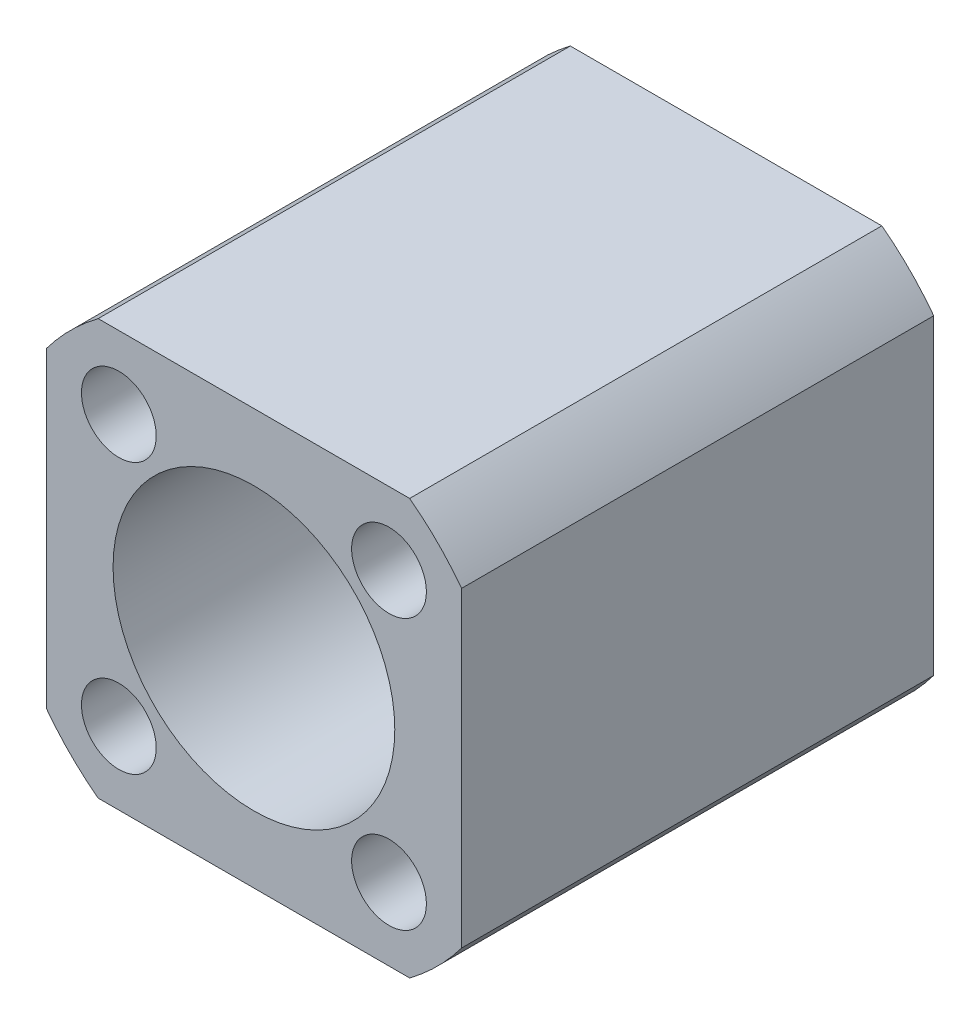
from build123d import *

# Parameters (mm, degrees)
SKETCH_1_R          = 9
EXTRUDE_1_DEPTH     = 113.684766057
EXTRUDE_START       = -113.684766057
EXTRUDE_3_OUTLINE_R = 33.917711518
EXTRUDE_3_DEPTH     = 113.684766057


# Read off the part's stored shape, not the designer's step: Вырез-Вытянуть3
with BuildPart() as part:
    # Эскиз1 → Бобышка-Вытянуть1 (new body)
    with BuildSketch(Plane.XY):
        with BuildLine():
            ThreePointArc((-50, -37.5), (-44.194173824, -44.194173824), (-37.5, -50))
            Line((-37.5, -50), (37.5, -50))
            ThreePointArc((37.5, -50), (44.194173824, -44.194173824), (50, -37.5))
            Line((50, -37.5), (50, 37.5))
            ThreePointArc((50, 37.5), (44.194173824, 44.194173824), (37.5, 50))
            Line((37.5, 50), (-37.5, 50))
            ThreePointArc((-37.5, 50), (-44.194173824, 44.194173824), (-50, 37.5))
            Line((-50, 37.5), (-50, -37.5))
        make_face()
        with Locations((-32.526911935, -32.526911935)):
            Circle(SKETCH_1_R, mode=Mode.SUBTRACT)
        with Locations((32.526911935, -32.526911935)):
            Circle(SKETCH_1_R, mode=Mode.SUBTRACT)
        with Locations((-32.526911935, 32.526911935)):
            Circle(SKETCH_1_R, mode=Mode.SUBTRACT)
        with Locations((32.526911935, 32.526911935)):
            Circle(SKETCH_1_R, mode=Mode.SUBTRACT)
    extrude(amount=EXTRUDE_1_DEPTH)

    # Вырез-Вытянуть3 outline → Вырез-Вытянуть3 (cut)
    with BuildSketch(Plane.XY.offset(113.684766057).offset(EXTRUDE_START)):
        Circle(EXTRUDE_3_OUTLINE_R)
    extrude(amount=EXTRUDE_3_DEPTH, mode=Mode.SUBTRACT)


solid = part.part
